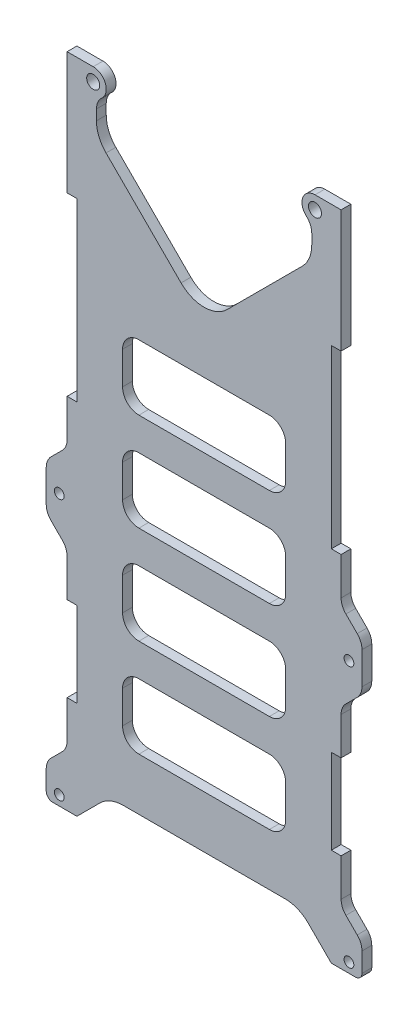
from build123d import *

# Parameters (mm, degrees)
SKETCH1_R           = 1.5
SKETCH1_R_2         = 2
BOSS_EXTRUDE1_DEPTH = 3


with BuildPart() as part:
    # Sketch1 → Boss-Extrude1 (new body)
    with BuildSketch(Plane.XY):
        with BuildLine():
            Line((46.4, -100.75), (39, -100.75))
            Line((39, -100.75), (31.928932188, -93.678932188))
            ThreePointArc((31.928932188, -93.678932188), (28.6846987, -91.511204675), (24.857864376, -90.75))
            Line((24.857864376, -90.75), (0, -90.75))
            Line((0, -90.75), (-24.857864376, -90.75))
            ThreePointArc((-24.857864376, -90.75), (-28.6846987, -91.511204675), (-31.928932188, -93.678932188))
            Line((-31.928932188, -93.678932188), (-39, -100.75))
            Line((-39, -100.75), (-46.4, -100.75))
            ThreePointArc((-46.4, -100.75), (-47.814213562, -100.164213562), (-48.4, -98.75))
            Line((-48.4, -98.75), (-48.4, -92.821067812))
            ThreePointArc((-48.4, -92.821067812), (-48.019397663, -90.90765065), (-46.935533906, -89.285533906))
            Line((-46.935533906, -89.285533906), (-43.464466094, -85.814466094))
            ThreePointArc((-43.464466094, -85.814466094), (-42.380602337, -84.19234935), (-42, -82.278932188))
            Line((-42, -82.278932188), (-42, -70.75))
            Line((-42, -70.75), (-39, -70.75))
            Line((-39, -70.75), (-39, -44.75))
            Line((-39, -44.75), (-42, -44.75))
            Line((-42, -44.75), (-42, -33.221067812))
            ThreePointArc((-42, -33.221067812), (-42.380602337, -31.30765065), (-43.464466094, -29.685533906))
            Line((-43.464466094, -29.685533906), (-46.935533906, -26.214466094))
            ThreePointArc((-46.935533906, -26.214466094), (-48.019397663, -24.59234935), (-48.4, -22.678932188))
            Line((-48.4, -22.678932188), (-48.4, -12.821067812))
            ThreePointArc((-48.4, -12.821067812), (-48.019397663, -10.90765065), (-46.935533906, -9.285533906))
            Line((-46.935533906, -9.285533906), (-43.464466094, -5.814466094))
            ThreePointArc((-43.464466094, -5.814466094), (-42.380602337, -4.19234935), (-42, -2.278932188))
            Line((-42, -2.278932188), (-42, 9.25))
            Line((-42, 9.25), (-39, 9.25))
            Line((-39, 9.25), (-39, 63.25))
            Line((-39, 63.25), (-42, 63.25))
            Line((-42, 63.25), (-42, 100.75))
            Line((-42, 100.75), (-34, 100.75))
            ThreePointArc((-34, 100.75), (-30.263310564, 98.177288359), (-31.333333333, 93.76857603))
            ThreePointArc((-31.333333333, 93.76857603), (-32.564354646, 92.08303752), (-33, 90.041796067))
            Line((-33, 90.041796067), (-33, 86.892135624))
            ThreePointArc((-33, 86.892135624), (-32.238795325, 83.0653013), (-30.071067812, 79.821067812))
            Line((-30.071067812, 79.821067812), (-7.071067812, 56.821067812))
            ThreePointArc((-7.071067812, 56.821067812), (0, 53.892135624), (7.071067812, 56.821067812))
            Line((7.071067812, 56.821067812), (30.071067812, 79.821067812))
            ThreePointArc((30.071067812, 79.821067812), (32.238795325, 83.0653013), (33, 86.892135624))
            Line((33, 86.892135624), (33, 90.041796067))
            ThreePointArc((33, 90.041796067), (32.564354646, 92.08303752), (31.333333333, 93.76857603))
            ThreePointArc((31.333333333, 93.76857603), (30.263310564, 98.177288359), (34, 100.75))
            Line((34, 100.75), (42, 100.75))
            Line((42, 100.75), (42, 63.25))
            Line((42, 63.25), (39, 63.25))
            Line((39, 63.25), (39, 9.25))
            Line((39, 9.25), (42, 9.25))
            Line((42, 9.25), (42, -2.278932188))
            ThreePointArc((42, -2.278932188), (42.380602337, -4.19234935), (43.464466094, -5.814466094))
            Line((43.464466094, -5.814466094), (46.935533906, -9.285533906))
            ThreePointArc((46.935533906, -9.285533906), (48.019397663, -10.90765065), (48.4, -12.821067812))
            Line((48.4, -12.821067812), (48.4, -22.678932188))
            ThreePointArc((48.4, -22.678932188), (48.019397663, -24.59234935), (46.935533906, -26.214466094))
            Line((46.935533906, -26.214466094), (43.464466094, -29.685533906))
            ThreePointArc((43.464466094, -29.685533906), (42.380602337, -31.30765065), (42, -33.221067812))
            Line((42, -33.221067812), (42, -44.75))
            Line((42, -44.75), (39, -44.75))
            Line((39, -44.75), (39, -70.75))
            Line((39, -70.75), (42, -70.75))
            Line((42, -70.75), (42, -82.278932188))
            ThreePointArc((42, -82.278932188), (42.380602337, -84.19234935), (43.464466094, -85.814466094))
            Line((43.464466094, -85.814466094), (46.935533906, -89.285533906))
            ThreePointArc((46.935533906, -89.285533906), (48.019397663, -90.90765065), (48.4, -92.821067812))
            Line((48.4, -92.821067812), (48.4, -98.75))
            ThreePointArc((48.4, -98.75), (47.814213562, -100.164213562), (46.4, -100.75))
        make_face()
        with Locations((44.4, -17.75)):
            Circle(SKETCH1_R, mode=Mode.SUBTRACT)
        with Locations((44.4, -97.75)):
            Circle(SKETCH1_R, mode=Mode.SUBTRACT)
        with Locations((34, 96.75)):
            Circle(SKETCH1_R_2, mode=Mode.SUBTRACT)
        with Locations((-34, 96.75)):
            Circle(SKETCH1_R_2, mode=Mode.SUBTRACT)
        with Locations((-44.4, -97.75)):
            Circle(SKETCH1_R, mode=Mode.SUBTRACT)
        with Locations((-44.4, -17.75)):
            Circle(SKETCH1_R, mode=Mode.SUBTRACT)
        with BuildLine():
            Line((-25, -69.75), (-25, -59.75))
            ThreePointArc((-25, -59.75), (-23.535533906, -56.214466094), (-20, -54.75))
            Line((-20, -54.75), (20, -54.75))
            ThreePointArc((20, -54.75), (23.535533906, -56.214466094), (25, -59.75))
            Line((25, -59.75), (25, -69.75))
            ThreePointArc((25, -69.75), (23.535533906, -73.285533906), (20, -74.75))
            Line((20, -74.75), (-20, -74.75))
            ThreePointArc((-20, -74.75), (-23.535533906, -73.285533906), (-25, -69.75))
        make_face(mode=Mode.SUBTRACT)
        with BuildLine():
            Line((-25, 20.25), (-25, 30.25))
            ThreePointArc((-25, 30.25), (-23.535533906, 33.785533906), (-20, 35.25))
            Line((-20, 35.25), (20, 35.25))
            ThreePointArc((20, 35.25), (23.535533906, 33.785533906), (25, 30.25))
            Line((25, 30.25), (25, 20.25))
            ThreePointArc((25, 20.25), (23.535533906, 16.714466094), (20, 15.25))
            Line((20, 15.25), (-20, 15.25))
            ThreePointArc((-20, 15.25), (-23.535533906, 16.714466094), (-25, 20.25))
        make_face(mode=Mode.SUBTRACT)
        with BuildLine():
            Line((-25, -39.75), (-25, -29.75))
            ThreePointArc((-25, -29.75), (-23.535533906, -26.214466094), (-20, -24.75))
            Line((-20, -24.75), (20, -24.75))
            ThreePointArc((20, -24.75), (23.535533906, -26.214466094), (25, -29.75))
            Line((25, -29.75), (25, -39.75))
            ThreePointArc((25, -39.75), (23.535533906, -43.285533906), (20, -44.75))
            Line((20, -44.75), (-20, -44.75))
            ThreePointArc((-20, -44.75), (-23.535533906, -43.285533906), (-25, -39.75))
        make_face(mode=Mode.SUBTRACT)
        with BuildLine():
            Line((-25, -9.75), (-25, 0.25))
            ThreePointArc((-25, 0.25), (-23.535533906, 3.785533906), (-20, 5.25))
            Line((-20, 5.25), (20, 5.25))
            ThreePointArc((20, 5.25), (23.535533906, 3.785533906), (25, 0.25))
            Line((25, 0.25), (25, -9.75))
            ThreePointArc((25, -9.75), (23.535533906, -13.285533906), (20, -14.75))
            Line((20, -14.75), (-20, -14.75))
            ThreePointArc((-20, -14.75), (-23.535533906, -13.285533906), (-25, -9.75))
        make_face(mode=Mode.SUBTRACT)
    extrude(amount=BOSS_EXTRUDE1_DEPTH)


solid = part.part
